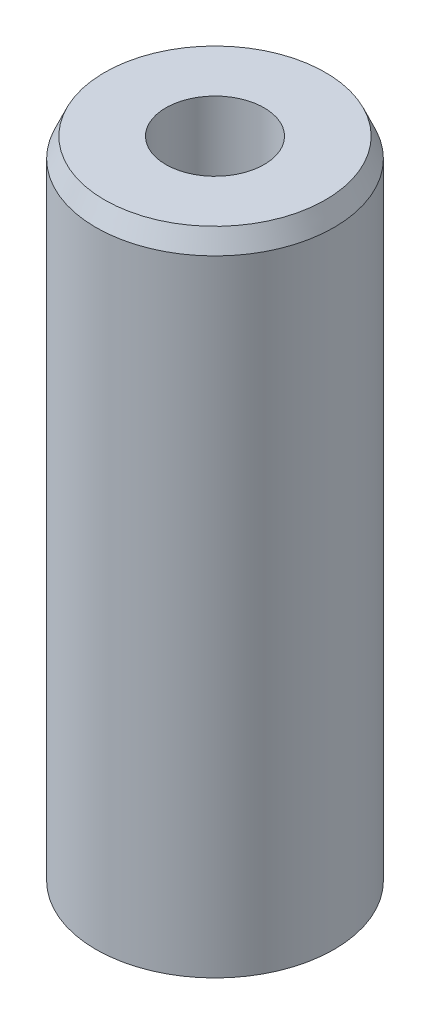
from build123d import *
from OCP.BRepFilletAPI import BRepFilletAPI_MakeChamfer

# Parameters (mm, degrees)
SKETCH1_R           = 25
BOSS_EXTRUDE1_DEPTH = 137.203772065
SKETCH2_R           = 10.325955009
CUT_EXTRUDE1_DEPTH  = 142.68583228
CHAMFER1_SIZE       = 4.107447917
CHAMFER1_SIZE2      = 1.811723788


with BuildPart() as part:
    # Sketch1 → Boss-Extrude1 (new body)
    with BuildSketch(Plane(origin=(0, 0, 0), x_dir=(1, 0, 0), z_dir=(0, 1, 0))):
        Circle(SKETCH1_R)
    extrude(amount=BOSS_EXTRUDE1_DEPTH)

    # Sketch2 → Cut-Extrude1 (cut, through all)
    with BuildSketch(Plane(origin=(0, 0, 0), x_dir=(1, 0, 0), z_dir=(0, 1, 0))):
        Circle(SKETCH2_R)
    extrude(amount=CUT_EXTRUDE1_DEPTH, mode=Mode.SUBTRACT)

    # Chamfer1: one chamfer whose edges measure the first distance from different faces: ONE call of the kernel's chamfer builder (chamfer() names one face for all edges)
    chamfer1_edges_1 = [part.edges().sort_by_distance(p)[0] for p in [
        (-25, 137.203772065, 0),
    ]]
    chamfer1_side_1 = [part.faces().sort_by_distance(p)[0] for p in [
        (-25, 68.601886032, 0),
    ]]
    chamfer1_edges_2 = [part.edges().sort_by_distance(p)[0] for p in [
        (-25, 0, 0),
    ]]
    chamfer1_side_2 = [part.faces().sort_by_distance(p)[0] for p in [
        (-24.292893219, 0, 0),
    ]]
    chamfer1 = BRepFilletAPI_MakeChamfer(part.part.solid().wrapped)
    for e in chamfer1_edges_1:
        chamfer1.Add(CHAMFER1_SIZE, CHAMFER1_SIZE2, e.wrapped, chamfer1_side_1[0].wrapped)  # the first distance lies on this face
    for e in chamfer1_edges_2:
        chamfer1.Add(CHAMFER1_SIZE, CHAMFER1_SIZE2, e.wrapped, chamfer1_side_2[0].wrapped)  # the first distance lies on this face
    add(Compound.cast(chamfer1.Shape()), mode=Mode.REPLACE)


solid = part.part
